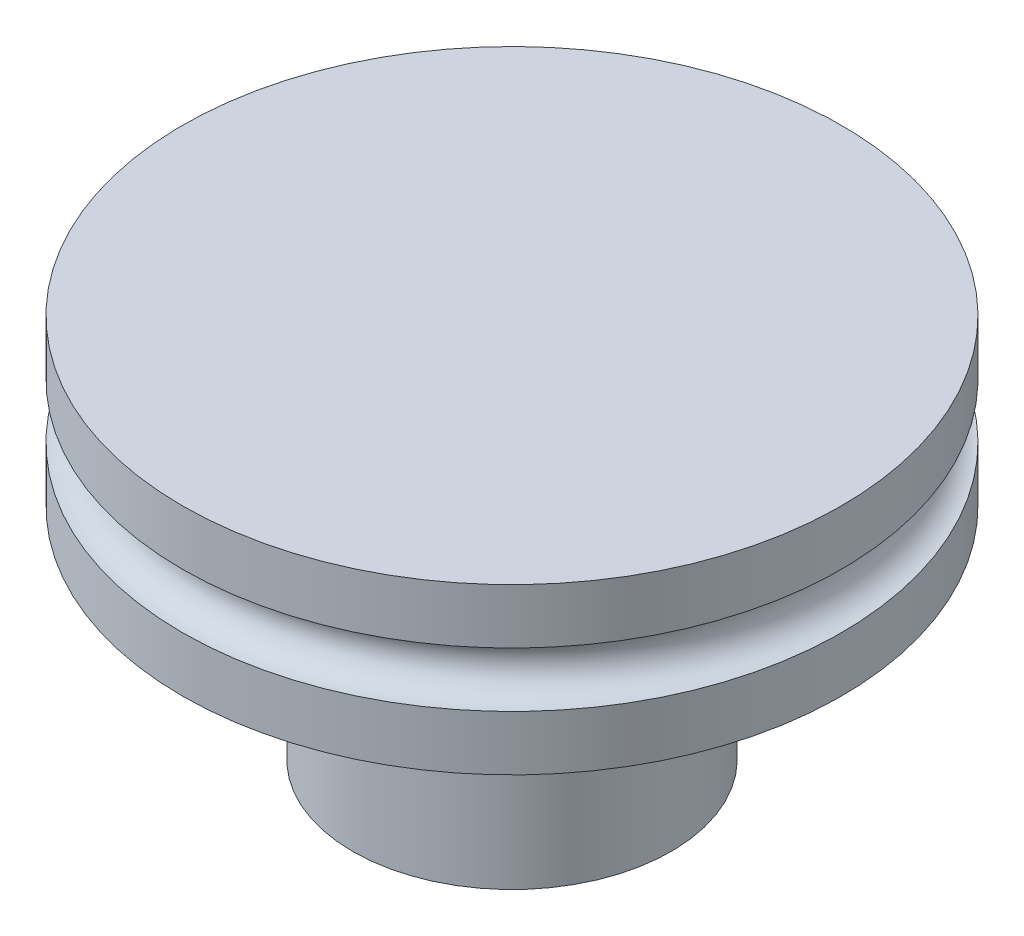
from build123d import *

# Parameters (mm, degrees)
SKETCH1_R           = 2.9
BOSS_EXTRUDE1_DEPTH = 3
SKETCH4_R           = 3.6
BOSS_EXTRUDE3_DEPTH = 1
SKETCH2_R           = 6
BOSS_EXTRUDE2_DEPTH = 3
SKETCH3_R           = 0.5


with BuildPart() as part:
    # Sketch1 → Boss-Extrude1 (new body)
    with BuildSketch(Plane(origin=(0, 0, 0), x_dir=(1, 0, 0), z_dir=(0, 1, 0))):
        Circle(SKETCH1_R)
    extrude(amount=BOSS_EXTRUDE1_DEPTH)

    # Sketch4 → Boss-Extrude3 (add)
    with BuildSketch(Plane(origin=(0, 3, 0), x_dir=(1, 0, 0), z_dir=(0, 1, 0))):
        Circle(SKETCH4_R)
    extrude(amount=BOSS_EXTRUDE3_DEPTH)

    # Sketch2 → Boss-Extrude2 (add)
    with BuildSketch(Plane(origin=(0, 4, 0), x_dir=(1, 0, 0), z_dir=(0, 1, 0))):
        Circle(SKETCH2_R)
    extrude(amount=BOSS_EXTRUDE2_DEPTH)

    # Sketch3 → Cut-Revolve1 (revolve, cut)
    with BuildSketch(Plane.XY):
        with Locations((-6, 5.5)):
            Circle(SKETCH3_R)
    revolve(axis=Axis((0, 9.115200414, 0), (0, -1, 0)), mode=Mode.SUBTRACT)


solid = part.part
